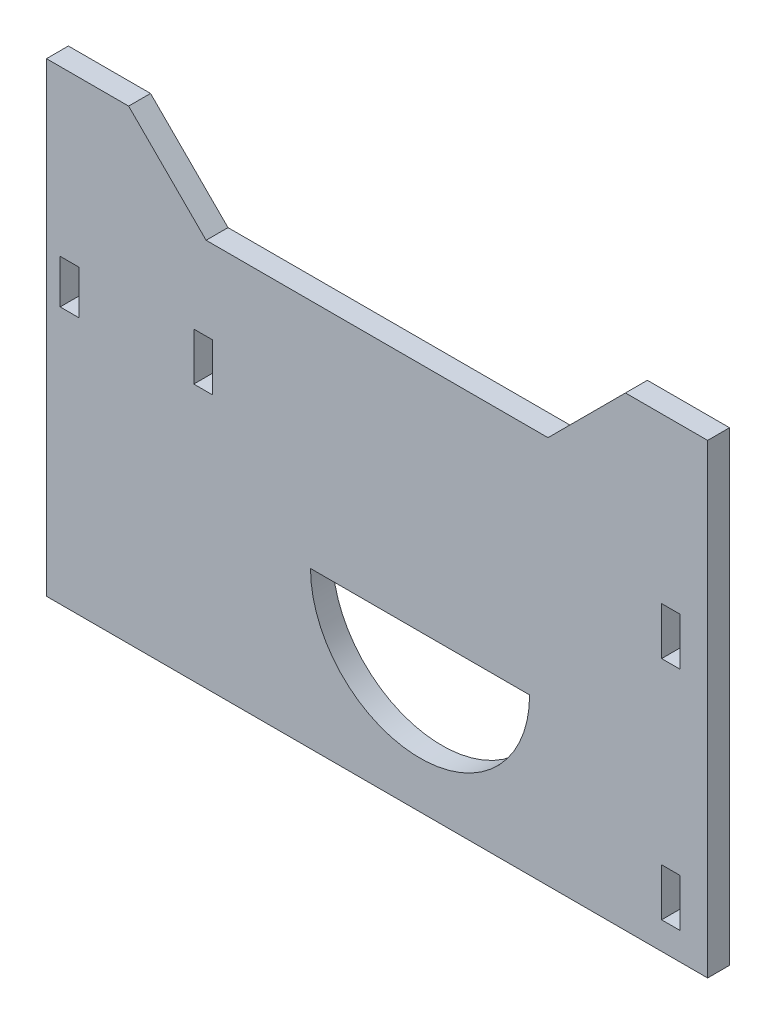
from build123d import *

# Parameters (mm, degrees)
SKETCH1_W           = 120.7
SKETCH1_H           = 60
SKETCH1_W_2         = 3.4
SKETCH1_H_2         = 8.7
SKETCH1_H_3         = 8
BOSS_EXTRUDE1_DEPTH = 4
BOSS_EXTRUDE2_DEPTH = 4


with BuildPart() as part:
    # Sketch1 → Boss-Extrude1 (new body)
    with BuildSketch(Plane.XY):
        with Locations((-7.85, 0)):
            Rectangle(SKETCH1_W, SKETCH1_H)
        with BuildLine():
            Line((-20, -1.498357325), (20, -1.498357325))
            ThreePointArc((20, -1.498357325), (0, -21.498357325), (-20, -1.498357325))
        make_face(mode=Mode.SUBTRACT)
        with Locations((-39.6, 21.35)):
            Rectangle(SKETCH1_W_2, SKETCH1_H_2, mode=Mode.SUBTRACT)
        with Locations((45.8, 20.65)):
            Rectangle(SKETCH1_W_2, SKETCH1_H_2, mode=Mode.SUBTRACT)
        with Locations((45.8, -20.65)):
            Rectangle(SKETCH1_W_2, SKETCH1_H_2, mode=Mode.SUBTRACT)
        with Locations((-64, 21)):
            Rectangle(SKETCH1_W_2, SKETCH1_H_3, mode=Mode.SUBTRACT)
    extrude(amount=BOSS_EXTRUDE1_DEPTH)

    # Sketch2 → Boss-Extrude2 (add)
    with BuildSketch(Plane.XY):
        Polygon((-68.2, 30), (52.5, 30), (52.5, 55), (37.5, 55), (23.357864376, 40.857864376), (-39.057864376, 40.857864376), (-53.2, 55), (-68.2, 55), align=None)
    extrude(amount=BOSS_EXTRUDE2_DEPTH)


solid = part.part
